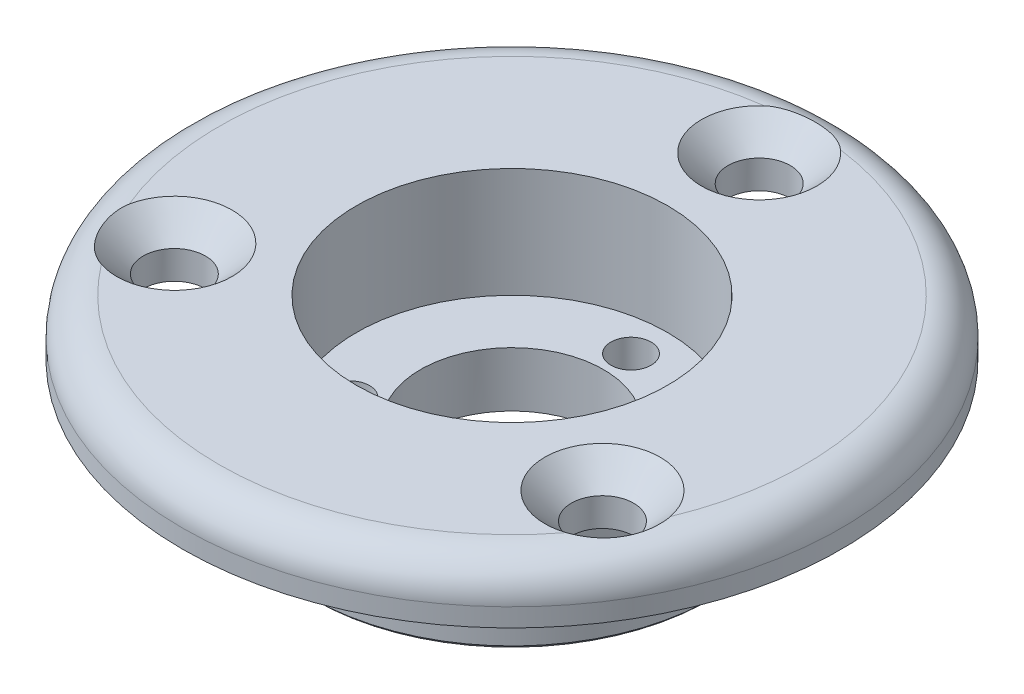
from build123d import *

# Parameters (mm, degrees)
CHANFREIN1_SIZE                                = 0.2
FRAISAGE_POUR_VIS_T_TE_FRAIS_E_M31_D           = 3.4
FRAISAGE_POUR_VIS_T_TE_FRAIS_E_M31_CSINK_D     = 6.3
FRAISAGE_POUR_VIS_T_TE_FRAIS_E_M31_CSINK_ANGLE = 90
CONG_1_R                                       = 2
FRAISAGE_POUR_VIS_T_TE_FRAIS_E_M22_D           = 2.2
FRAISAGE_POUR_VIS_T_TE_FRAIS_E_M22_CSINK_D     = 4.4
FRAISAGE_POUR_VIS_T_TE_FRAIS_E_M22_CSINK_ANGLE = 90


with BuildPart() as part:
    # Esquisse1 → Révolution1 (revolve)
    with BuildSketch(Plane(origin=(0, 0, 0), x_dir=(0, 0, -1), z_dir=(1, 0, 0))):
        Polygon((-5, -3), (-5, 0), (-8.5, 0), (-8.5, 6), (-18, 6), (-18, 3), (-11, 3), (-11, -3), align=None)
    revolve(axis=Axis((0, 0, 0), (0, -1, 0)))

    # Chanfrein1
    chanfrein1_edges = [part.edges().sort_by_distance(p)[0] for p in [
        (0, -3, -11),
    ]]
    chamfer(chanfrein1_edges, length=CHANFREIN1_SIZE)

    # Fraisage pour vis à tête fraisée M31 (through all)
    with Locations(Plane(origin=(0, 6, -13.5), x_dir=(0, 0, 1), z_dir=(0, 1, 0))):
        with Locations((0, 0), (20.25, 11.691342951), (20.25, -11.691342951)):
            CounterSinkHole(FRAISAGE_POUR_VIS_T_TE_FRAIS_E_M31_D / 2, FRAISAGE_POUR_VIS_T_TE_FRAIS_E_M31_CSINK_D / 2, counter_sink_angle=FRAISAGE_POUR_VIS_T_TE_FRAIS_E_M31_CSINK_ANGLE)

    # Congé1
    # the kernel refuses this fillet: 2 mm, written as the material it takes off along each edge
    with BuildSketch(Plane(origin=(0, 6, 0), x_dir=(0, 0, 1), z_dir=(1, 0, 0))) as cong_1_piece_1:
        with BuildLine():
            CenterArc((18 - CONG_1_R, CONG_1_R), CONG_1_R, 270, 90)
            Line((18, CONG_1_R), (18, 0))
            Line((18, 0), (18 - CONG_1_R, 0))
        make_face()
    revolve(axis=Axis((0, 6, 0), (0, -1, 0)), mode=Mode.SUBTRACT)

    # Fraisage pour vis à tête fraisée M22 (through all)
    with Locations(Plane(origin=(0, -3, 0), x_dir=(-1, 0, 0), z_dir=(0, -1, 0))):
        with Locations((0, 6.5), (-5.629165125, -3.25), (5.629165125, -3.25)):
            CounterSinkHole(FRAISAGE_POUR_VIS_T_TE_FRAIS_E_M22_D / 2, FRAISAGE_POUR_VIS_T_TE_FRAIS_E_M22_CSINK_D / 2, counter_sink_angle=FRAISAGE_POUR_VIS_T_TE_FRAIS_E_M22_CSINK_ANGLE)


solid = part.part
